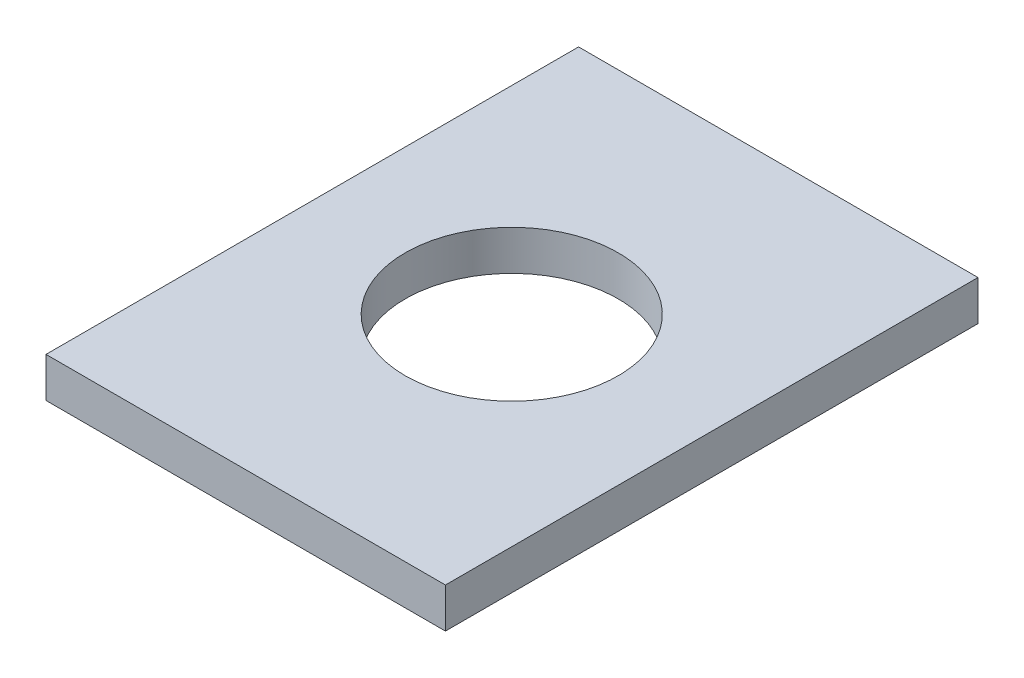
from build123d import *

# Parameters (mm, degrees)
BOSS_EXTRUDE1_DEPTH = 20
BOSS_EXTRUDE2_DEPTH = 1.5
SKETCH3_W           = 10
SKETCH3_H           = 2
BOSS_EXTRUDE3_DEPTH = 100
SKETCH4_R           = 1.55
CUT_EXTRUDE1_DEPTH  = 2
SKETCH5_R           = 4
CUT_EXTRUDE2_DEPTH  = 3
CUT_EXTRUDE3_START  = -2
CUT_EXTRUDE3_DEPTH  = 2
SKETCH7_W           = 92.843167551
SKETCH7_H           = 36.119357845
CUT_EXTRUDE4_DEPTH  = 30
SKETCH8_W           = 90.626752411
SKETCH8_H           = 35.380552798
CUT_EXTRUDE5_DEPTH  = 55
SKETCH10_W          = 29.390209747
SKETCH10_H          = 30.061690813
CUT_EXTRUDE7_DEPTH  = 20
SKETCH11_W          = 23.008025921
SKETCH11_H          = 26.899718038
CUT_EXTRUDE8_DEPTH  = 40


# Read off the part's stored shape, not the designer's step: Boss-Extrude1, Cut-Extrude3
with BuildPart() as part:
    # Boss-Extrude1 outline → Boss-Extrude1 (new body)
    with BuildSketch(Plane(origin=(0, 0, 0), x_dir=(1, 0, 0), z_dir=(0, 1, 0))):
        with BuildLine():
            Line((49.999999852, 30), (4.999999852, 30))
            ThreePointArc((4.999999852, 30), (1.464465946, 31.464466094), (-1.48e-07, 35))
            Line((-1.48e-07, 35), (-1.48e-07, 40))
            Line((-1.48e-07, 40), (-40.000000148, 40))
            Line((-40.000000148, 40), (-40.000000111, 35))
            ThreePointArc((-40.000000111, 35), (-41.464466194, 31.46446612), (-45.000000074, 30.000000037))
            Line((-45.000000074, 30.000000037), (-50.000000148, 30))
            Line((-50.000000148, 30), (-50.000000148, -30))
            Line((-50.000000148, -30), (49.999999852, -30))
            Line((49.999999852, -30), (49.999999852, 30))
        make_face()
        with BuildLine():
            Line((-48.5, 28.5), (-44.999018222, 28.5))
            ThreePointArc((-44.999018222, 28.5), (-40.40345882, 30.40415302), (-38.5, 35))
            Line((-38.5, 35), (-38.5, 38.5))
            Line((-38.5, 38.5), (-1.500000148, 38.5))
            Line((-1.500000148, 38.5), (-1.500000148, 35))
            ThreePointArc((-1.500000148, 35), (0.403805774, 30.403805922), (4.999999852, 28.5))
            Line((4.999999852, 28.5), (48.5, 28.5))
            Line((48.5, 28.5), (48.5, -28.5))
            Line((48.5, -28.5), (-48.5, -28.5))
            Line((-48.5, -28.5), (-48.5, 28.5))
        make_face(mode=Mode.SUBTRACT)
    extrude(amount=BOSS_EXTRUDE1_DEPTH)

    # Sketch2 → Boss-Extrude2 (add)
    with BuildSketch(Plane(origin=(0, 20, 0), x_dir=(1, 0, 0), z_dir=(0, 1, 0))):
        with BuildLine():
            Line((-40.000000148, 40), (-1.48e-07, 40))
            Line((-1.48e-07, 40), (-1.48e-07, 35))
            ThreePointArc((-1.48e-07, 35), (1.464465946, 31.464466094), (4.999999852, 30))
            Line((4.999999852, 30), (49.999999852, 30))
            Line((49.999999852, 30), (49.999999852, -30))
            Line((49.999999852, -30), (-50.000000148, -30))
            Line((-50.000000148, -30), (-50.000000148, 30))
            Line((-50.000000148, 30), (-45.000000074, 30))
            ThreePointArc((-45.000000074, 30), (-41.464466216, 31.46446612), (-40.000000148, 35))
            Line((-40.000000148, 35), (-40.000000148, 40))
        make_face()
    extrude(amount=BOSS_EXTRUDE2_DEPTH)

    # Sketch3 → Boss-Extrude3 (add)
    with BuildSketch(Plane(origin=(49.999999852, 0, 0), x_dir=(0, 0, -1), z_dir=(1, 0, 0))):
        with Locations((35, 1)):
            Rectangle(SKETCH3_W, SKETCH3_H)
        with Locations((-35, 1)):
            Rectangle(SKETCH3_W, SKETCH3_H)
    extrude(amount=-BOSS_EXTRUDE3_DEPTH)

    # Sketch4 → Cut-Extrude1 (cut)
    with BuildSketch(Plane.XZ):
        with Locations(Location((-45, 35, 0), (0, 0, 270))):
            Circle(SKETCH4_R)
        with Locations(Location((45, 35, 0), (0, 0, 270))):
            Circle(SKETCH4_R)
        with Locations(Location((45, -35, 0), (0, 0, 270))):
            Circle(SKETCH4_R)
        with Locations(Location((-45, -35, 0), (0, 0, 270))):
            Circle(SKETCH4_R)
        with Locations(Location((5, 35, 0), (0, 0, 270))):
            Circle(SKETCH4_R)
        with Locations(Location((5, -35, 0), (0, 0, 270))):
            Circle(SKETCH4_R)
    extrude(amount=-CUT_EXTRUDE1_DEPTH, mode=Mode.SUBTRACT)

    # Sketch5 → Cut-Extrude2 (cut)
    with BuildSketch(Plane(origin=(0, 21.5, 0), x_dir=(1, 0, 0), z_dir=(0, 1, 0))):
        with Locations(Location((12.44, -9.95, 0), (0, 0, 270))):
            Circle(SKETCH5_R)
    extrude(amount=-CUT_EXTRUDE2_DEPTH, mode=Mode.SUBTRACT)

    # Cut-Extrude3 outline → Cut-Extrude3 (cut)
    with BuildSketch(Plane(origin=(0, 2, 0), x_dir=(1, 0, 0), z_dir=(0, 1, 0)).offset(CUT_EXTRUDE3_START)):
        with BuildLine():
            Line((-38.5, 38.5), (-38.5, 35))
            ThreePointArc((-38.5, 35), (-39.115846372, 32.238345392), (-40.846688027, 30))
            Line((-40.846688027, 30), (0.84668792, 30))
            ThreePointArc((0.84668792, 30), (-0.884153764, 32.238345383), (-1.500000148, 35))
            Line((-1.500000148, 35), (-1.500000148, 38.5))
            Line((-1.500000148, 38.5), (-38.5, 38.5))
        make_face()
    extrude(amount=CUT_EXTRUDE3_DEPTH, mode=Mode.SUBTRACT)

    # Sketch7 → Cut-Extrude4 (cut)
    with BuildSketch(Plane(origin=(49.999999852, 0, 0), x_dir=(0, 0, -1), z_dir=(1, 0, 0))):
        with Locations((0.287313074, 10.115071794)):
            Rectangle(SKETCH7_W, SKETCH7_H)
    extrude(amount=-CUT_EXTRUDE4_DEPTH, mode=Mode.SUBTRACT)

    # Sketch8 → Cut-Extrude5 (cut)
    with BuildSketch(Plane.ZY.offset(50.000000148)):
        with Locations((-1.067162845, 10.564009403)):
            Rectangle(SKETCH8_W, SKETCH8_H)
    extrude(amount=-CUT_EXTRUDE5_DEPTH, mode=Mode.SUBTRACT)

    # Sketch10 → Cut-Extrude7 (cut)
    with BuildSketch(Plane.XY.offset(40)):
        with Locations((11.70310279, 9.975782262)):
            Rectangle(SKETCH10_W, SKETCH10_H)
    extrude(amount=-CUT_EXTRUDE7_DEPTH, mode=Mode.SUBTRACT)

    # Sketch11 → Cut-Extrude8 (cut)
    with BuildSketch(Plane(origin=(0, 0, -40), x_dir=(-1, 0, 0), z_dir=(0, 0, -1))):
        with Locations((-13.617747202, 10.15531134)):
            Rectangle(SKETCH11_W, SKETCH11_H)
    extrude(amount=-CUT_EXTRUDE8_DEPTH, mode=Mode.SUBTRACT)


solid = part.part
